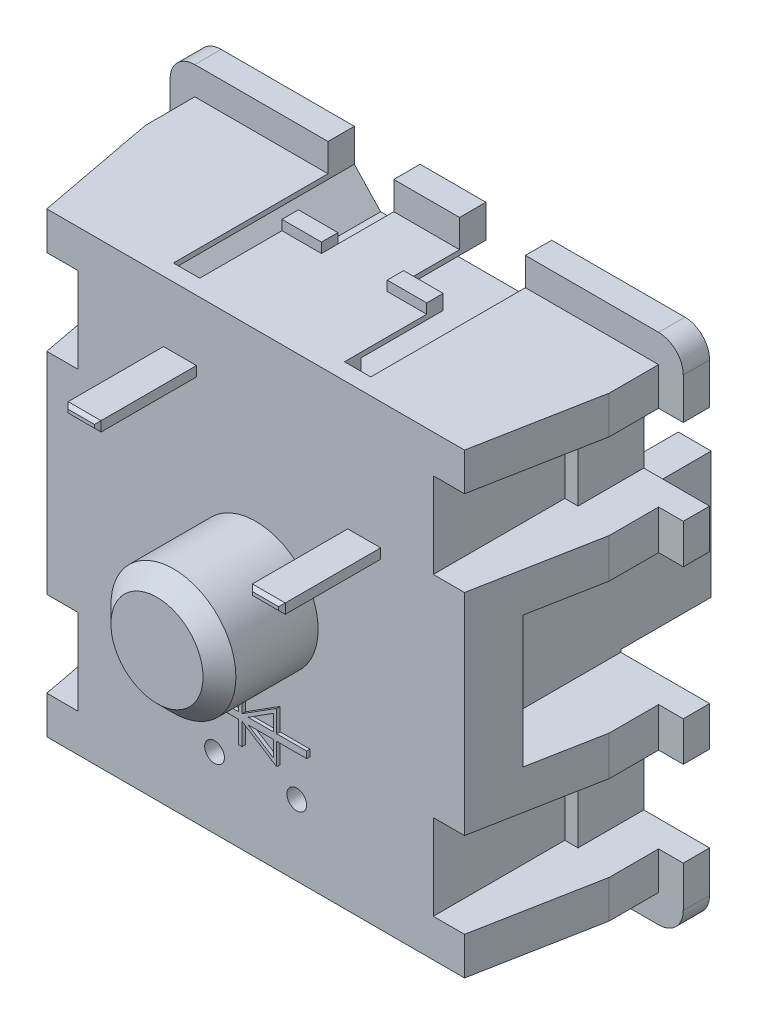
from build123d import *

# Parameters (mm, degrees)
SKETCH1_W                = 15.6
SKETCH1_H                = 15.6
BOSS_EXTRUDE1_DEPTH      = 6
SKETCH2_R                = 1.9
BOSS_EXTRUDE2_DEPTH      = 3
CHAMFER1_SIZE            = 0.5
SKETCH4_W                = 1
SKETCH4_H                = 0.3
BOSS_EXTRUDE3_DEPTH      = 3
CHAMFER2_SIZE            = 0.1
CUT_EXTRUDE2_DEPTH       = 20.626512681
SKETCH7_W                = 6
SKETCH7_H                = 2.6
CUT_EXTRUDE3_DEPTH       = 2
SKETCH8_W                = 4
SKETCH8_H                = 2.6
CUT_EXTRUDE4_DEPTH       = 0.4
MIRROR3_COPY_1_SKETCH_W  = 6
MIRROR3_COPY_1_SKETCH_H  = 2.6
MIRROR3_COPY_1_DEPTH     = 2
MIRROR3_COPY_2_SKETCH_W  = 4
MIRROR3_COPY_2_SKETCH_H  = 2.6
MIRROR3_COPY_2_DEPTH     = 0.4
SKETCH9_W                = 4.5
SKETCH9_H                = 4
CUT_EXTRUDE5_DEPTH       = 2.7
SHELL1_DEPTH             = 5
SHELL1_START             = 5
SHELL1_2_OUTLINE_R       = 0.9
SHELL1_2_DEPTH           = 3
SHELL1_3_OUTLINE_W       = 0.4
SHELL1_3_OUTLINE_H       = 3.8
SHELL1_3_DEPTH           = 1
SKETCH3_R                = 0.3
CUT_EXTRUDE1_DEPTH       = 13.557069722
SKETCH10_W               = 1
SKETCH10_H               = 3.85
BOSS_EXTRUDE4_DEPTH      = 3
CHAMFER3_SIZE            = 0.25
SKETCH11_W               = 5.2
SKETCH11_H               = 0.85
CUT_EXTRUDE6_DEPTH       = 20.626512681
FILLET1_R                = 0.75
CUT_EXTRUDE7_REACH       = 21.627
SKETCH12_W               = 2
SKETCH12_H               = 2.5
SKETCH13_W               = 0.8
SKETCH13_H               = 3
CUT_EXTRUDE8_DEPTH       = 1
MIRROR8_COPY_1_REACH     = 21.627
MIRROR8_COPY_1_SKETCH_W  = 2
MIRROR8_COPY_1_SKETCH_H  = 2.5
MIRROR8_COPY_2_SKETCH_W  = 0.8
MIRROR8_COPY_2_SKETCH_H  = 3
MIRROR8_COPY_2_DEPTH     = 1
SKETCH14_W               = 9.6
SKETCH14_H               = 1
BOSS_EXTRUDE5_DEPTH      = 5
SKETCH15_R               = 1.5
SKETCH15_R_2             = 1
BOSS_EXTRUDE6_DEPTH      = 7
CHAMFER4_SIZE            = 0.25
BOSS_EXTRUDE7_DEPTH      = 5
BOSS_EXTRUDE7_DEPTH_BACK = 1
SKETCH17_W               = 1.2
SKETCH17_H               = 0.5
BOSS_EXTRUDE8_DEPTH      = 0.3
MIRROR10_COPY_1_SKETCH_W = 1.2
MIRROR10_COPY_1_SKETCH_H = 0.5
MIRROR10_COPY_1_DEPTH    = 0.3
EXTRUDE_THIN1_DEPTH      = 0.1


# Read off the part's stored shape, not the designer's step: Shell1, Extrude-Thin1
with BuildPart() as part:
    # Sketch1 → Boss-Extrude1 (new body)
    with BuildSketch(Plane.XY):
        Rectangle(SKETCH1_W, SKETCH1_H)
    extrude(amount=BOSS_EXTRUDE1_DEPTH)

    # Sketch2 → Boss-Extrude2 (add)
    with BuildSketch(Plane.XY.offset(6)):
        Circle(SKETCH2_R)
    extrude(amount=BOSS_EXTRUDE2_DEPTH)

    # Chamfer1
    chamfer1_edges = [part.edges().sort_by_distance(p)[0] for p in [
        (-1.9, 0, 9),
    ]]
    chamfer(chamfer1_edges, length=CHAMFER1_SIZE)

    # Sketch4 → Boss-Extrude3 (add)
    with BuildSketch(Plane.XY.offset(6)):
        with Locations((-2.3, 4.95)):
            Rectangle(SKETCH4_W, SKETCH4_H)
        with Locations((3.3, 2.95)):
            Rectangle(SKETCH4_W, SKETCH4_H)
    extrude(amount=BOSS_EXTRUDE3_DEPTH)

    # Chamfer2
    chamfer2_edges = [part.edges().sort_by_distance(p)[0] for p in [
        (-2.8, 4.95, 9),
        (-2.3, 4.8, 9),
        (-1.8, 4.95, 9),
        (-2.3, 5.1, 9),
        (2.8, 2.95, 9),
        (3.3, 2.8, 9),
        (3.8, 2.95, 9),
        (3.3, 3.1, 9),
    ]]
    chamfer(chamfer2_edges, length=CHAMFER2_SIZE)

    # Sketch6 → Cut-Extrude2 (cut, through all)
    with BuildSketch(Plane(origin=(0, 7.8, 0), x_dir=(1, 0, 0), z_dir=(0, 1, 0))):
        Polygon((-7.8, -0.8), (-7.8, -6), (-6.35, -6), (-7.05, -2.3), (-7.05, -0.8), align=None)
    cut_extrude2 = extrude(amount=-CUT_EXTRUDE2_DEPTH, mode=Mode.SUBTRACT)

    # Mirror1: Cut-Extrude2 across plane
    add(cut_extrude2.mirror(Plane(origin=(0, 0, 0), x_dir=(0, 0, 1), z_dir=(1, 0, 0))), mode=Mode.SUBTRACT)

    # Sketch7 → Cut-Extrude3 (cut)
    with BuildSketch(Plane.ZY.offset(7.8)):
        with Locations((3, 4.5)):
            Rectangle(SKETCH7_W, SKETCH7_H)
    cut_extrude3 = extrude(amount=-CUT_EXTRUDE3_DEPTH, mode=Mode.SUBTRACT)

    # Sketch8 → Cut-Extrude4 (cut)
    with BuildSketch(Plane.ZY.offset(5.8)):
        with Locations((4, 4.5)):
            Rectangle(SKETCH8_W, SKETCH8_H)
    cut_extrude4 = extrude(amount=-CUT_EXTRUDE4_DEPTH, mode=Mode.SUBTRACT)

    # Mirror2: Cut-Extrude3, Cut-Extrude4 across plane
    add(cut_extrude3.mirror(Plane.ZX), mode=Mode.SUBTRACT)
    add(cut_extrude4.mirror(Plane.ZX), mode=Mode.SUBTRACT)

    # Mirror3: Cut-Extrude3, Cut-Extrude4 across plane
    add(cut_extrude3.mirror(Plane(origin=(0, 0, 0), x_dir=(0, 0, 1), z_dir=(1, 0, 0))), mode=Mode.SUBTRACT)
    add(cut_extrude4.mirror(Plane(origin=(0, 0, 0), x_dir=(0, 0, 1), z_dir=(1, 0, 0))), mode=Mode.SUBTRACT)

    # Mirror3 copy 1 sketch → Mirror3 copy 1 (cut)
    with BuildSketch(Plane(origin=(7.8, 0, 0), x_dir=(0, 0, 1), z_dir=(1, 0, 0))):
        with Locations((3, 4.5)):
            Rectangle(MIRROR3_COPY_1_SKETCH_W, MIRROR3_COPY_1_SKETCH_H)
    extrude(amount=-MIRROR3_COPY_1_DEPTH, mode=Mode.SUBTRACT)

    # Mirror3 copy 2 sketch → Mirror3 copy 2 (cut)
    with BuildSketch(Plane(origin=(5.8, 0, 0), x_dir=(0, 0, 1), z_dir=(1, 0, 0))):
        with Locations((4, 4.5)):
            Rectangle(MIRROR3_COPY_2_SKETCH_W, MIRROR3_COPY_2_SKETCH_H)
    extrude(amount=-MIRROR3_COPY_2_DEPTH, mode=Mode.SUBTRACT)

    # Sketch9 → Cut-Extrude5 (cut)
    with BuildSketch(Plane.ZY.offset(7.8)):
        with Locations((2.25, 0)):
            Rectangle(SKETCH9_W, SKETCH9_H)
    cut_extrude5 = extrude(amount=-CUT_EXTRUDE5_DEPTH, mode=Mode.SUBTRACT)

    # Mirror4: Cut-Extrude5 across plane
    add(cut_extrude5.mirror(Plane(origin=(0, 0, 0), x_dir=(0, 0, 1), z_dir=(1, 0, 0))), mode=Mode.SUBTRACT)

    # Shell1 outline → Shell1 (cut)
    with BuildSketch(Plane.XY):
        Polygon((4.4, 3), (4.4, 6.8), (-4.4, 6.8), (-4.4, 3), (-4.1, 3), (-4.1, -3), (-4.4, -3), (-4.4, -6.8), (4.4, -6.8), (4.4, -3), (4.1, -3), (4.1, 3), align=None)
    extrude(amount=SHELL1_DEPTH, mode=Mode.SUBTRACT)

    # Shell1 2 outline → Shell1 2 (cut)
    with BuildSketch(Plane.XY.offset(SHELL1_START)):
        Circle(SHELL1_2_OUTLINE_R)
    extrude(amount=SHELL1_2_DEPTH, mode=Mode.SUBTRACT)

    # Shell1 3 outline → Shell1 3 (cut)
    with BuildSketch(Plane.XY):
        with Locations((4.6, 4.9)):
            Rectangle(SHELL1_3_OUTLINE_W, SHELL1_3_OUTLINE_H)
        with Locations((-4.6, 4.9)):
            Rectangle(SHELL1_3_OUTLINE_W, SHELL1_3_OUTLINE_H)
        with Locations((4.6, -4.9)):
            Rectangle(SHELL1_3_OUTLINE_W, SHELL1_3_OUTLINE_H)
        with Locations((-4.6, -4.9)):
            Rectangle(SHELL1_3_OUTLINE_W, SHELL1_3_OUTLINE_H)
    extrude(amount=SHELL1_3_DEPTH, mode=Mode.SUBTRACT)

    # Sketch3 → Cut-Extrude1 (cut, through all)
    with BuildSketch(Plane.XY.offset(6)):
        with Locations((-1.25, -4.8)):
            Circle(SKETCH3_R)
        with Locations((1.25, -4.8)):
            Circle(SKETCH3_R)
    extrude(amount=-CUT_EXTRUDE1_DEPTH, mode=Mode.SUBTRACT)

    # Sketch10 → Boss-Extrude4 (add)
    with BuildSketch(Plane(origin=(0, 0, 0), x_dir=(-1, 0, 0), z_dir=(0, 0, -1))):
        with Locations((4.6, 0)):
            Rectangle(SKETCH10_W, SKETCH10_H)
    boss_extrude4 = extrude(amount=BOSS_EXTRUDE4_DEPTH)

    # Mirror5: Boss-Extrude4 across plane
    add(boss_extrude4.mirror(Plane(origin=(0, 0, 0), x_dir=(0, 0, 1), z_dir=(1, 0, 0))))

    # Chamfer3
    chamfer3_edges = [part.edges().sort_by_distance(p)[0] for p in [
        (-4.1, 0, -3),
        (-4.6, -1.925, -3),
        (-5.1, 0, -3),
        (-4.6, 1.925, -3),
        (4.1, 0, -3),
        (4.6, 1.925, -3),
        (5.1, 0, -3),
        (4.6, -1.925, -3),
    ]]
    chamfer(chamfer3_edges, length=CHAMFER3_SIZE)

    # Sketch11 → Cut-Extrude6 (cut, through all)
    with BuildSketch(Plane.ZY.offset(7.8)):
        with Locations((3.4, 7.375)):
            Rectangle(SKETCH11_W, SKETCH11_H)
    cut_extrude6 = extrude(amount=-CUT_EXTRUDE6_DEPTH, mode=Mode.SUBTRACT)

    # Mirror6: Cut-Extrude6 across plane
    add(cut_extrude6.mirror(Plane.ZX), mode=Mode.SUBTRACT)

    # Fillet1
    fillet1_edges = [part.edges().sort_by_distance(p)[0] for p in [
        (-7.8, -7.8, 0.4),
        (-7.8, 7.8, 0.4),
        (7.8, -7.8, 0.4),
        (7.8, 7.8, 0.4),
    ]]
    fillet(fillet1_edges, radius=FILLET1_R)

    # Sketch12 → Cut-Extrude7 (cut, up to next)
    with BuildSketch(Plane(origin=(0, 7.8, 0), x_dir=(1, 0, 0), z_dir=(0, 1, 0)), mode=Mode.PRIVATE) as cut_extrude7_sk1:
        with Locations((-2, -1.25)):
            Rectangle(SKETCH12_W, SKETCH12_H)
    cut_extrude7_tool1 = extrude(cut_extrude7_sk1.sketch, amount=-CUT_EXTRUDE7_REACH, mode=Mode.PRIVATE) & part.part
    cut_extrude7 = cut_extrude7_tool1.solids().sort_by_distance((-2, 7.8, 1.25))[0]
    add(cut_extrude7, mode=Mode.SUBTRACT)

    # Sketch13 → Cut-Extrude8 (cut)
    with BuildSketch(Plane(origin=(0, 6.95, 0), x_dir=(1, 0, 0), z_dir=(0, 1, 0))):
        with Locations((-2.6, -4)):
            Rectangle(SKETCH13_W, SKETCH13_H)
    cut_extrude8 = extrude(amount=-CUT_EXTRUDE8_DEPTH, mode=Mode.SUBTRACT)

    # Mirror7: Cut-Extrude7, Cut-Extrude8 across plane
    add(cut_extrude7.mirror(Plane(origin=(0, 0, 0), x_dir=(0, 0, 1), z_dir=(1, 0, 0))), mode=Mode.SUBTRACT)
    add(cut_extrude8.mirror(Plane(origin=(0, 0, 0), x_dir=(0, 0, 1), z_dir=(1, 0, 0))), mode=Mode.SUBTRACT)

    # Mirror8: Cut-Extrude7, Cut-Extrude8 across plane
    add(cut_extrude7.mirror(Plane.ZX), mode=Mode.SUBTRACT)
    add(cut_extrude8.mirror(Plane.ZX), mode=Mode.SUBTRACT)

    # Mirror8 copy 1 sketch → Mirror8 copy 1 (cut, up to next)
    with BuildSketch(Plane(origin=(0, -7.8, 0), x_dir=(-1, 0, 0), z_dir=(0, -1, 0)), mode=Mode.PRIVATE) as mirror8_copy_1_sk1:
        with Locations((-2, -1.25)):
            Rectangle(MIRROR8_COPY_1_SKETCH_W, MIRROR8_COPY_1_SKETCH_H)
    mirror8_copy_1_tool1 = extrude(mirror8_copy_1_sk1.sketch, amount=-MIRROR8_COPY_1_REACH, mode=Mode.PRIVATE) & part.part
    add(mirror8_copy_1_tool1.solids().sort_by_distance((2, -7.8, 1.25))[0], mode=Mode.SUBTRACT)

    # Mirror8 copy 2 sketch → Mirror8 copy 2 (cut)
    with BuildSketch(Plane(origin=(0, -6.95, 0), x_dir=(-1, 0, 0), z_dir=(0, -1, 0))):
        with Locations((-2.6, -4)):
            Rectangle(MIRROR8_COPY_2_SKETCH_W, MIRROR8_COPY_2_SKETCH_H)
    extrude(amount=-MIRROR8_COPY_2_DEPTH, mode=Mode.SUBTRACT)

    # Sketch14 → Boss-Extrude5 (add)
    with BuildSketch(Plane(origin=(0, 0, 5), x_dir=(-1, 0, 0), z_dir=(0, 0, -1))):
        with Locations((0, -3.8)):
            Rectangle(SKETCH14_W, SKETCH14_H)
    extrude(amount=BOSS_EXTRUDE5_DEPTH)

    # Sketch15 → Boss-Extrude6 (add)
    with BuildSketch(Plane(origin=(0, 0, 8), x_dir=(-1, 0, 0), z_dir=(0, 0, -1))):
        with Locations(Location((0, 0, 0), (0, 0, 180))):
            Circle(SKETCH15_R)
        with Locations(Location((0, 0, 0), (0, 0, 180))):
            Circle(SKETCH15_R_2, mode=Mode.SUBTRACT)
    extrude(amount=BOSS_EXTRUDE6_DEPTH)

    # Chamfer4
    chamfer4_edges = [part.edges().sort_by_distance(p)[0] for p in [
        (-1.5, 0, 1),
    ]]
    chamfer(chamfer4_edges, length=CHAMFER4_SIZE)

    # Sketch16 → Boss-Extrude7 (add, two sides: drawn at the far end of the back side and taken through both)
    with BuildSketch(Plane(origin=(0, 0, 5), x_dir=(-1, 0, 0), z_dir=(0, 0, -1)).offset(-BOSS_EXTRUDE7_DEPTH_BACK)):
        Polygon((-3, 6.8), (-2.2, 5.95), (2.2, 5.95), (3, 6.8), (3.3, 6.8), (3.3, 6.6), (3.08641453, 6.6), (2.28641453, 5.75), (-2.28641453, 5.75), (-3.08641453, 6.6), (-3.3, 6.6), (-3.3, 6.8), align=None)
    extrude(amount=BOSS_EXTRUDE7_DEPTH + BOSS_EXTRUDE7_DEPTH_BACK)

    # Sketch17 → Boss-Extrude8 (add)
    with BuildSketch(Plane.XZ.offset(6.95)):
        with Locations((1.6, 2.75)):
            Rectangle(SKETCH17_W, SKETCH17_H)
    boss_extrude8 = extrude(amount=BOSS_EXTRUDE8_DEPTH)

    # Mirror9: Boss-Extrude8 across plane
    add(boss_extrude8.mirror(Plane(origin=(0, 0, 0), x_dir=(0, 0, 1), z_dir=(1, 0, 0))))

    # Mirror10: Boss-Extrude8 across plane
    add(boss_extrude8.mirror(Plane.ZX))

    # Mirror10 copy 1 sketch → Mirror10 copy 1 (add)
    with BuildSketch(Plane(origin=(0, 6.95, 0), x_dir=(-1, 0, 0), z_dir=(0, 1, 0))):
        with Locations((1.6, 2.75)):
            Rectangle(MIRROR10_COPY_1_SKETCH_W, MIRROR10_COPY_1_SKETCH_H)
    extrude(amount=MIRROR10_COPY_1_DEPTH)

    # Extrude-Thin1 outline → Extrude-Thin1 (add)
    with BuildSketch(Plane.XY.offset(6)):
        Polygon((-1.226431416, -3.373862375), (-0.414209702, -3.373862375), (-0.414209702, -3.455761099), (-0.285157167, -3.373862375), (1.652134883, -3.373862375), (1.652134883, -3.273862375), (0.739913168, -3.273862375), (0.739913168, -2.604899785), (-0.314209702, -3.273862375), (-0.314209702, -2.604899785), (-0.414209702, -2.604899785), (-0.414209702, -3.273862375), (-1.226431416, -3.273862375), align=None)
        Polygon((0.639913168, -2.786798508), (0.639913168, -3.273862375), (-0.12758141, -3.273862375), align=None, mode=Mode.SUBTRACT)
    extrude_thin1 = extrude(amount=EXTRUDE_THIN1_DEPTH)

    # Mirror11: Extrude-Thin1 across plane
    add(extrude_thin1.mirror(Plane(origin=(-1.226431416, -3.373862375, 6.1), x_dir=(0, 0, 1), z_dir=(0, 1, 0))))


solid = part.part
